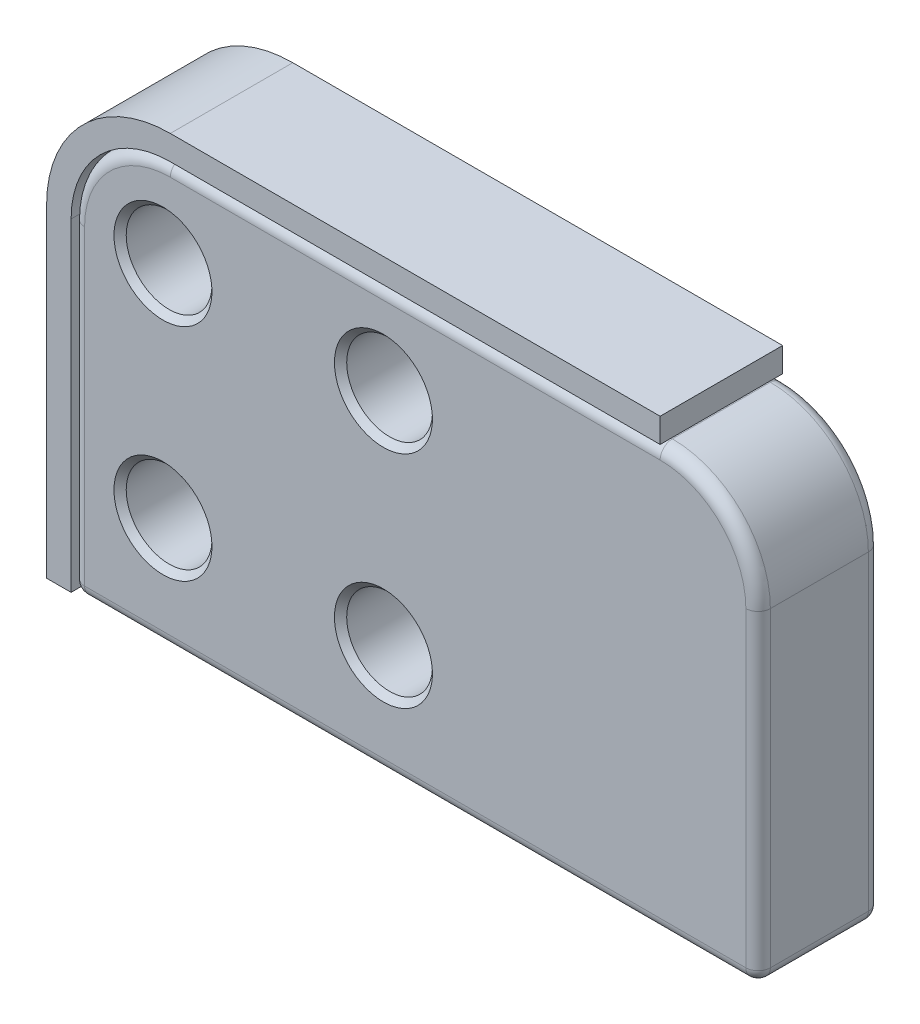
from build123d import *

# Parameters (mm, degrees)
SKETCH1_W           = 55.99
SKETCH1_H           = 87.9
SKETCH1_R           = 3.5
BOSS_EXTRUDE1_DEPTH = 10
FILLET1_R           = 8
FILLET2_R           = 1
CHAMFER1_SIZE       = 0.5
BOSS_EXTRUDE2_DEPTH = 10


# Read off the part's stored shape, not the designer's step: Split1
with BuildPart() as part:
    # Sketch1 → Boss-Extrude1 (new body)
    with BuildSketch(Plane.XY):
        with Locations((-17.995, 31.45)):
            Rectangle(SKETCH1_W, SKETCH1_H)
        Circle(SKETCH1_R, mode=Mode.SUBTRACT)
        with Locations((-6.59, 32)):
            Circle(SKETCH1_R, mode=Mode.SUBTRACT)
        with Locations((-20.59, 32)):
            Circle(SKETCH1_R, mode=Mode.SUBTRACT)
        with Locations((-14, 0)):
            Circle(SKETCH1_R, mode=Mode.SUBTRACT)
        with Locations((-20.59, 50)):
            Circle(SKETCH1_R, mode=Mode.SUBTRACT)
        with Locations((-20.59, 68)):
            Circle(SKETCH1_R, mode=Mode.SUBTRACT)
        with Locations((-38.59, 68)):
            Circle(SKETCH1_R, mode=Mode.SUBTRACT)
        with Locations((-38.59, 50)):
            Circle(SKETCH1_R, mode=Mode.SUBTRACT)
    extrude(amount=BOSS_EXTRUDE1_DEPTH)

    # Fillet1
    fillet1_edges = [part.edges().sort_by_distance(p)[0] for p in [
        (-45.99, -12.5, 5),
        (-45.99, 75.4, 5),
        (10, 75.4, 5),
        (10, -12.5, 5),
    ]]
    fillet(fillet1_edges, radius=FILLET1_R)


with BuildPart() as body_2:
    # Split1: the piece on the far side of the plane
    add(part.part)
    split(bisect_by=Plane(origin=(0, 41, 0), x_dir=(1, 0, 0), z_dir=(0, 1, 0)), keep=Keep.BOTTOM)


with BuildPart() as part_1:
    add(part.part)

    # Split1
    split(bisect_by=Plane(origin=(0, 41, 0), x_dir=(1, 0, 0), z_dir=(0, 1, 0)), keep=Keep.TOP)

    # Fillet2
    fillet2_edges = [part_1.edges().sort_by_distance(p)[0] for p in [
        (-17.995, 41, 0),
        (-45.99, 54.2, 0),
        (-17.995, 75.4, 0),
        (7.656854249, 73.056854249, 0),
        (-43.646854249, 73.056854249, 0),
        (-17.995, 75.4, 10),
        (-45.99, 54.2, 10),
        (7.656854249, 73.056854249, 10),
        (-43.646854249, 73.056854249, 10),
        (-45.99, 41, 5),
        (10, 54.2, 10),
        (10, 54.2, 0),
        (10, 41, 5),
        (-17.995, 41, 10),
    ]]
    fillet(fillet2_edges, radius=FILLET2_R)

    # Chamfer1
    chamfer1_edges = [part_1.edges().sort_by_distance(p)[0] for p in [
        (-24.09, 50, 0),
        (-24.09, 50, 10),
        (-24.09, 68, 0),
        (-24.09, 68, 10),
        (-42.09, 68, 0),
        (-42.09, 68, 10),
        (-42.09, 50, 0),
        (-42.09, 50, 10),
    ]]
    chamfer(chamfer1_edges, length=CHAMFER1_SIZE)


with BuildPart() as body_2_2:
    # Sketch4 → Boss-Extrude2 (new body)
    with BuildSketch(Plane.XY):
        with BuildLine():
            Line((2, 77.5), (-37.99, 77.5))
            ThreePointArc((-37.99, 77.5), (-45.13177849, 74.54177849), (-48.09, 67.4))
            Line((-48.09, 67.4), (-48.09, 41))
            Line((-48.09, 41), (-46.09, 41))
            Line((-46.09, 41), (-46.09, 67.4))
            ThreePointArc((-46.09, 67.4), (-43.717564928, 73.127564928), (-37.99, 75.5))
            Line((-37.99, 75.5), (2, 75.5))
            Line((2, 75.5), (2, 77.5))
        make_face()
    extrude(amount=BOSS_EXTRUDE2_DEPTH)


solid = Compound([part_1.part, body_2_2.part])
